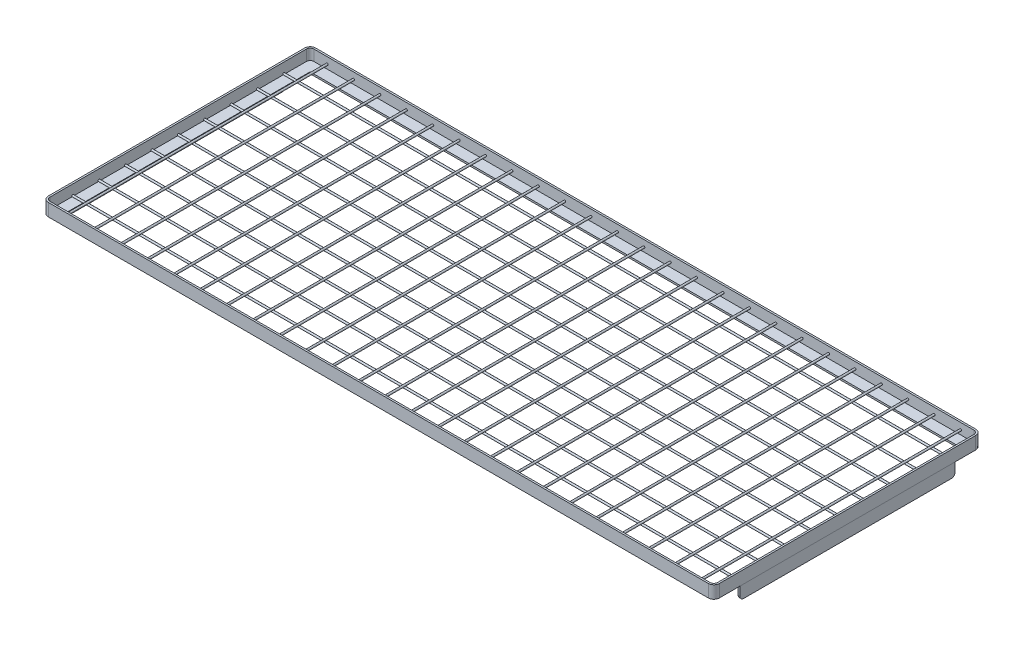
from build123d import *

# Parameters (mm, degrees)
BOSS_EXTRUDE1_DEPTH  = 21.844
BOSS_EXTRUDE2_START  = 3.556
SKETCH3_W            = 1305.687
SKETCH3_H            = 489.712
BOSS_EXTRUDE2_DEPTH  = 3.556
BOSS_EXTRUDE13_REACH = 1381.833
SKETCH10_R           = 1.905
LPATTERN1_COUNT      = 5
LPATTERN1_PITCH      = 53.34
LPATTERN1_COUNT_DIR2 = 5
LPATTERN1_PITCH_DIR2 = 53.34
SKETCH8_W            = 434.975
SKETCH8_H            = 25.4
BOSS_EXTRUDE11_DEPTH = 3.556
BOSS_EXTRUDE14_REACH = 867.549
SKETCH11_R           = 1.905
LPATTERN2_COUNT      = 13
LPATTERN2_PITCH      = 53.34
LPATTERN2_COUNT_DIR2 = 13
LPATTERN2_PITCH_DIR2 = 53.34
SKETCH9_W            = 434.975
SKETCH9_H            = 25.4
BOSS_EXTRUDE12_DEPTH = 3.556
FILLET1_R            = 7.62
FILLET2_R            = 7.62


with BuildPart() as part:
    # Sketch1 → Boss-Extrude1 (new body)
    with BuildSketch(Plane(origin=(0, 0, 0), x_dir=(1, 0, 0), z_dir=(0, 1, 0))):
        with BuildLine():
            Line((-667.0675, -270.256), (667.0675, -270.256))
            ThreePointArc((667.0675, -270.256), (674.970125387, -266.982625387), (678.2435, -259.08))
            Line((678.2435, -259.08), (678.2435, 259.08))
            ThreePointArc((678.2435, 259.08), (674.970125387, 266.982625387), (667.0675, 270.256))
            Line((667.0675, 270.256), (-667.0675, 270.256))
            ThreePointArc((-667.0675, 270.256), (-674.970125387, 266.982625387), (-678.2435, 259.08))
            Line((-678.2435, 259.08), (-678.2435, -259.08))
            ThreePointArc((-678.2435, -259.08), (-674.970125387, -266.982625387), (-667.0675, -270.256))
        make_face()
        with BuildLine():
            Line((-667.0675, -266.7), (667.0675, -266.7))
            ThreePointArc((667.0675, -266.7), (672.455653673, -264.468153673), (674.6875, -259.08))
            Line((674.6875, -259.08), (674.6875, 259.08))
            ThreePointArc((674.6875, 259.08), (672.455653673, 264.468153673), (667.0675, 266.7))
            Line((667.0675, 266.7), (-667.0675, 266.7))
            ThreePointArc((-667.0675, 266.7), (-672.455653673, 264.468153673), (-674.6875, 259.08))
            Line((-674.6875, 259.08), (-674.6875, -259.08))
            ThreePointArc((-674.6875, -259.08), (-672.455653673, -264.468153673), (-667.0675, -266.7))
        make_face(mode=Mode.SUBTRACT)
    extrude(amount=BOSS_EXTRUDE1_DEPTH)

    # Sketch3 → Boss-Extrude2 (add)
    with BuildSketch(Plane.XZ.offset(BOSS_EXTRUDE2_START)):
        with BuildLine():
            Line((-667.0675, 270.256), (667.0675, 270.256))
            ThreePointArc((667.0675, 270.256), (674.970125387, 266.982625387), (678.2435, 259.08))
            Line((678.2435, 259.08), (678.2435, -259.08))
            ThreePointArc((678.2435, -259.08), (674.970125387, -266.982625387), (667.0675, -270.256))
            Line((667.0675, -270.256), (-667.0675, -270.256))
            ThreePointArc((-667.0675, -270.256), (-674.970125387, -266.982625387), (-678.2435, -259.08))
            Line((-678.2435, -259.08), (-678.2435, 259.08))
            ThreePointArc((-678.2435, 259.08), (-674.970125387, 266.982625387), (-667.0675, 270.256))
        make_face()
        Rectangle(SKETCH3_W, SKETCH3_H, mode=Mode.SUBTRACT)
    extrude(amount=-BOSS_EXTRUDE2_DEPTH)

    # Sketch10 → Boss-Extrude13 (add, up to next)
    with BuildSketch(Plane(origin=(-674.6875, 0, 0), x_dir=(0, 0, -1), z_dir=(1, 0, 0)), mode=Mode.PRIVATE) as boss_extrude13_sk1:
        with Locations((0, 1.524)):
            Circle(SKETCH10_R)
    boss_extrude13_tool1 = extrude(boss_extrude13_sk1.sketch, amount=BOSS_EXTRUDE13_REACH, mode=Mode.PRIVATE) - part.part
    boss_extrude13 = boss_extrude13_tool1.solids().sort_by_distance((-674.6875, 1.524, 0))[0]
    add(boss_extrude13)

    # LPattern1: Boss-Extrude13 5 × 5
    with Locations(*[Vector(0, 0, 1) * (i * LPATTERN1_PITCH) + Vector(0, 0, -1) * (j * LPATTERN1_PITCH_DIR2) for i in range(LPATTERN1_COUNT) for j in range(LPATTERN1_COUNT_DIR2) if (i, j) != (0, 0)]):
        add(boss_extrude13)

    # Sketch11 → Boss-Extrude14 (add, up to next)
    with BuildSketch(Plane(origin=(0, 0, 266.7), x_dir=(-1, 0, 0), z_dir=(0, 0, -1)), mode=Mode.PRIVATE) as boss_extrude14_sk1:
        with Locations((0, 8.89)):
            Circle(SKETCH11_R)
    boss_extrude14_tool1 = extrude(boss_extrude14_sk1.sketch, amount=BOSS_EXTRUDE14_REACH, mode=Mode.PRIVATE) - part.part
    boss_extrude14 = boss_extrude14_tool1.solids().sort_by_distance((0, 8.89, 266.7))[0]
    add(boss_extrude14)

    # LPattern2: Boss-Extrude14 13 × 13
    with Locations(*[Vector(-1, 0, 0) * (i * LPATTERN2_PITCH) + Vector(1, 0, 0) * (j * LPATTERN2_PITCH_DIR2) for i in range(LPATTERN2_COUNT) for j in range(LPATTERN2_COUNT_DIR2) if (i, j) != (0, 0)]):
        add(boss_extrude14)


with BuildPart() as body_2:
    # Sketch8 → Boss-Extrude11 (new body)
    with BuildSketch(Plane.ZY.offset(678.2435)):
        with Locations((0, -16.256)):
            Rectangle(SKETCH8_W, SKETCH8_H)
    extrude(amount=-BOSS_EXTRUDE11_DEPTH)

    # Fillet1
    fillet1_edges = [body_2.edges().sort_by_distance(p)[0] for p in [
        (-676.4655, -28.956, 217.4875),
        (-676.4655, -28.956, -217.4875),
    ]]
    fillet(fillet1_edges, radius=FILLET1_R)


with BuildPart() as body_3:
    # Sketch9 → Boss-Extrude12 (new body)
    with BuildSketch(Plane(origin=(678.2435, 0, 0), x_dir=(0, 0, -1), z_dir=(1, 0, 0))):
        with Locations((0, -16.256)):
            Rectangle(SKETCH9_W, SKETCH9_H)
    extrude(amount=-BOSS_EXTRUDE12_DEPTH)

    # Fillet2
    fillet2_edges = [body_3.edges().sort_by_distance(p)[0] for p in [
        (676.4655, -28.956, -217.4875),
        (676.4655, -28.956, 217.4875),
    ]]
    fillet(fillet2_edges, radius=FILLET2_R)


solid = Compound([part.part, body_2.part, body_3.part])
